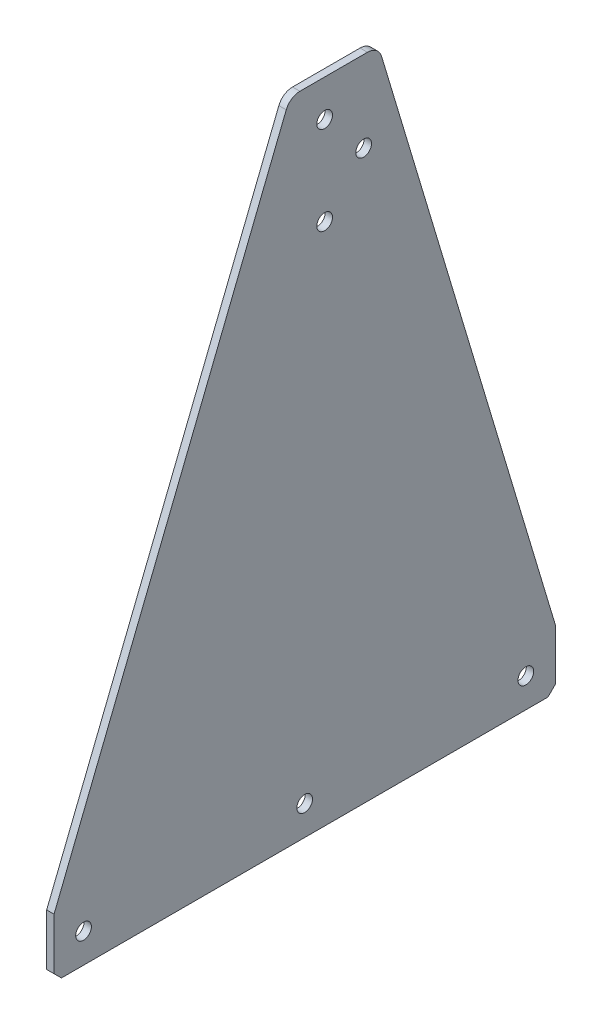
from build123d import *

# Parameters (mm, degrees)
BOSS_EXTRUDE1_DEPTH = 3.175
SKETCH3_R           = 3.3782
CUT_EXTRUDE2_DEPTH  = 354.110819184
SKETCH4_R           = 3.3782
CUT_EXTRUDE3_DEPTH  = 354.110819184
CHAMFER1_SIZE       = 3.175


with BuildPart() as part:
    # Sketch1 → Boss-Extrude1 (new body)
    with BuildSketch(Plane(origin=(0, 0, 0), x_dir=(0, 0, -1), z_dir=(1, 0, 0))):
        with BuildLine():
            Line((105.899159305, 279.4), (134.975405367, 279.4))
            ThreePointArc((134.975405367, 279.4), (138.76591423, 278.144560095), (141.057602278, 274.874659073))
            Line((141.057602278, 274.874659073), (215.9, 25.4))
            Line((215.9, 25.4), (215.9, 0))
            Line((215.9, 0), (0, 0))
            Line((0, 0), (0, 25.4))
            Line((0, 25.4), (100.003332318, 275.408330795))
            ThreePointArc((100.003332318, 275.408330795), (102.339166366, 278.308226913), (105.899159305, 279.4))
        make_face()
    extrude(amount=BOSS_EXTRUDE1_DEPTH)

    # Sketch3 → Cut-Extrude2 (cut, through all)
    with BuildSketch(Plane(origin=(3.175, 0, 0), x_dir=(0, 0, -1), z_dir=(1, 0, 0))):
        with Locations((133.35, 244.475)):
            Circle(SKETCH3_R)
        with Locations((116.549479175, 225.425)):
            Circle(SKETCH3_R)
        with Locations((116.549479175, 263.525)):
            Circle(SKETCH3_R)
    extrude(amount=-CUT_EXTRUDE2_DEPTH, mode=Mode.SUBTRACT)

    # Sketch4 → Cut-Extrude3 (cut, through all)
    with BuildSketch(Plane(origin=(3.175, 0, 0), x_dir=(0, 0, -1), z_dir=(1, 0, 0))):
        with Locations((12.7, 12.7)):
            Circle(SKETCH4_R)
        with Locations((107.95, 12.7)):
            Circle(SKETCH4_R)
        with Locations((203.2, 12.7)):
            Circle(SKETCH4_R)
    extrude(amount=-CUT_EXTRUDE3_DEPTH, mode=Mode.SUBTRACT)

    # Chamfer1
    chamfer1_edges = [part.edges().sort_by_distance(p)[0] for p in [
        (1.5875, 0, 0),
        (1.5875, 0, -215.9),
    ]]
    chamfer(chamfer1_edges, length=CHAMFER1_SIZE)


solid = part.part
